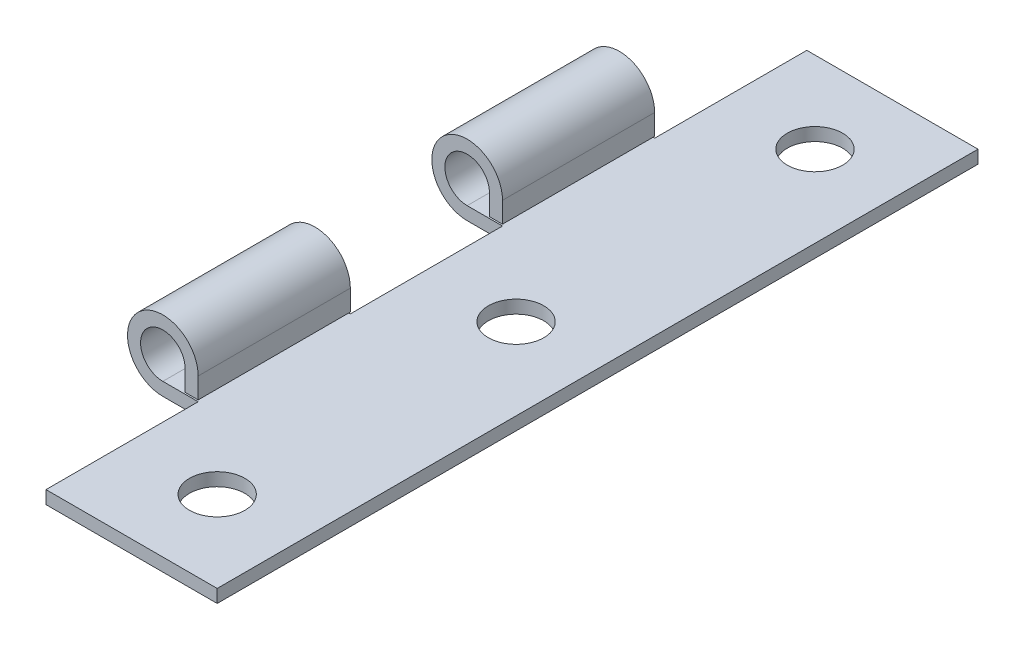
from build123d import *

# Parameters (mm, degrees)
SKETCH1_R           = 2.55
BASE_FLANGE1_DEPTH  = 1.2
BOSS_EXTRUDE1_DEPTH = 14
SKETCH11_W          = 1
SKETCH11_H          = 1.2
BOSS_EXTRUDE2_DEPTH = 14


# Sheet-metal steps are written as plain solids
with BuildPart() as part:
    # Sketch1 → Base-Flange1 (new body)
    with BuildSketch(Plane(origin=(0, 0, 0), x_dir=(1, 0, 0), z_dir=(0, 1, 0))):
        Polygon((0, 28), (0, 42), (-1, 42), (-1, 56), (0, 56), (0, 70), (15.75, 70), (15.75, 0), (0, 0), (0, 14), (-1, 14), (-1, 28), align=None)
        with Locations(Location((8.25, 62.5, 0), (0, 0, 270))):
            Circle(SKETCH1_R, mode=Mode.SUBTRACT)
        with Locations(Location((8.25, 35, 0), (0, 0, 270))):
            Circle(SKETCH1_R, mode=Mode.SUBTRACT)
        with Locations(Location((8.25, 7.5, 0), (0, 0, 270))):
            Circle(SKETCH1_R, mode=Mode.SUBTRACT)
    extrude(amount=-BASE_FLANGE1_DEPTH)

    # Sketch10 → Boss-Extrude1 (add)
    with BuildSketch(Plane.XY.offset(-42)):
        with BuildLine():
            Line((-3.25, -1.2), (-1, -1.2))
            Line((-1, -1.2), (0, -1.2))
            Line((0, -1.2), (0, 0))
            Line((0, 0), (-3.25, 0))
            ThreePointArc((-3.25, 0), (-4.699568901, 3.499568901), (-1.2, 2.05))
            Line((-1.2, 2.05), (-1.2, 0.145614193))
            Line((-1.2, 0.145614193), (0, 0.145614193))
            Line((0, 0.145614193), (0, 2.05))
            ThreePointArc((0, 2.05), (-5.548097039, 4.348097039), (-3.25, -1.2))
        make_face()
    extrude(amount=-BOSS_EXTRUDE1_DEPTH)

    # Sketch11 → Boss-Extrude2 (add)
    with BuildSketch(Plane.XY.offset(-14)):
        with BuildLine():
            ThreePointArc((-3.25, 0), (-4.699568901, 3.499568901), (-1.2, 2.05))
            Line((-1.2, 2.05), (-1.2, 0.145614193))
            Line((-1.2, 0.145614193), (0, 0.145614193))
            Line((0, 0.145614193), (-1.1e-07, 2.05))
            ThreePointArc((-1.1e-07, 2.05), (-5.548097133, 4.348096945), (-3.25, -1.2))
            Line((-3.25, -1.2), (-1, -1.2))
            Line((-1, -1.2), (-1, 0))
            Line((-1, 0), (-3.25, 0))
        make_face()
        with Locations((-0.5, -0.6)):
            Rectangle(SKETCH11_W, SKETCH11_H)
    extrude(amount=-BOSS_EXTRUDE2_DEPTH)


solid = part.part
